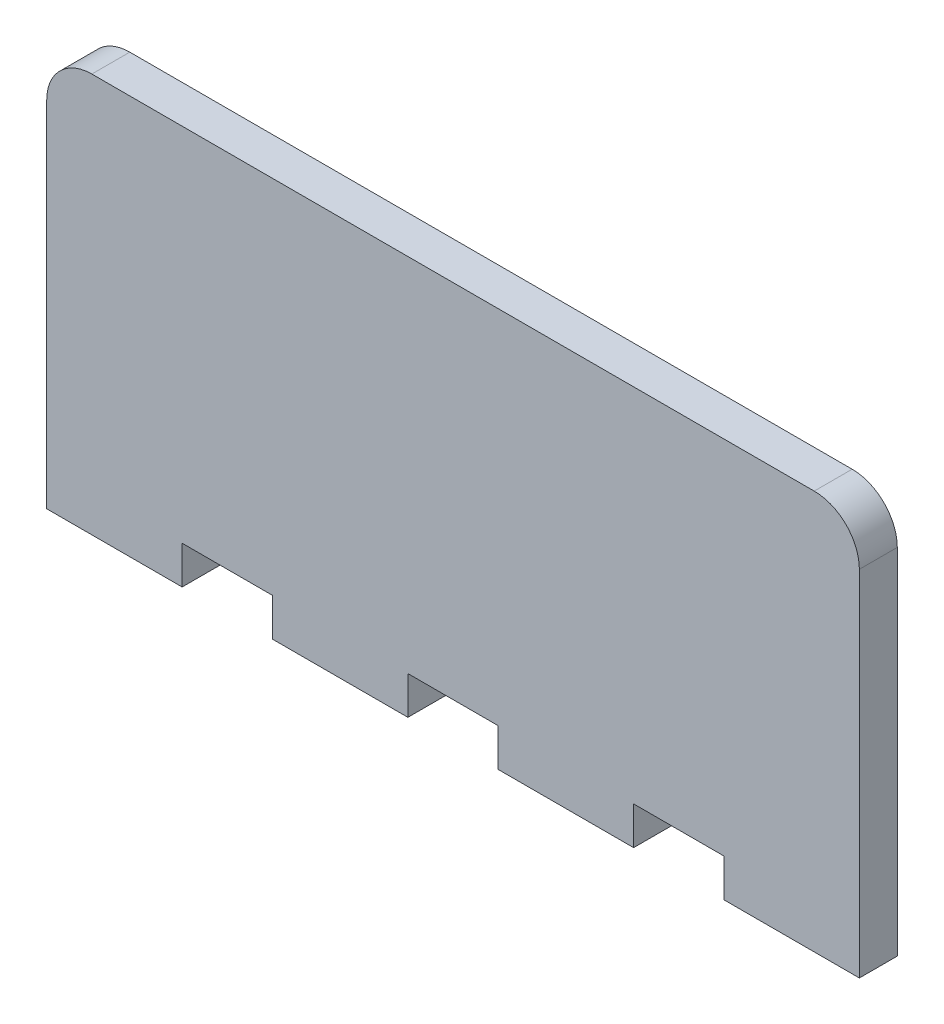
from build123d import *

# Parameters (mm, degrees)
SKETCH1_W           = 114.3
SKETCH1_H           = 56.134
BOSS_EXTRUDE1_DEPTH = 5.334
SKETCH2_W           = 12.7
SKETCH2_H           = 5.334
CUT_EXTRUDE1_DEPTH  = 90.417531181
FILLET1_R           = 6.35


with BuildPart() as part:
    # Sketch1 → Boss-Extrude1 (new body)
    with BuildSketch(Plane.XY):
        with Locations((26.61749153, -2.755892293)):
            Rectangle(SKETCH1_W, SKETCH1_H)
    extrude(amount=BOSS_EXTRUDE1_DEPTH)

    # Sketch2 → Cut-Extrude1 (cut, through all)
    with BuildSketch(Plane.XY.offset(5.334)):
        with Locations((-5.13250847, -28.155892293)):
            Rectangle(SKETCH2_W, SKETCH2_H)
        with Locations((26.61749153, -28.155892293)):
            Rectangle(SKETCH2_W, SKETCH2_H)
        with Locations((58.36749153, -28.155892293)):
            Rectangle(SKETCH2_W, SKETCH2_H)
    extrude(amount=-CUT_EXTRUDE1_DEPTH, mode=Mode.SUBTRACT)

    # Fillet1
    fillet1_edges = [part.edges().sort_by_distance(p)[0] for p in [
        (83.76749153, 25.311107707, 2.667),
        (-30.53250847, 25.311107707, 2.667),
    ]]
    fillet(fillet1_edges, radius=FILLET1_R)


solid = part.part
